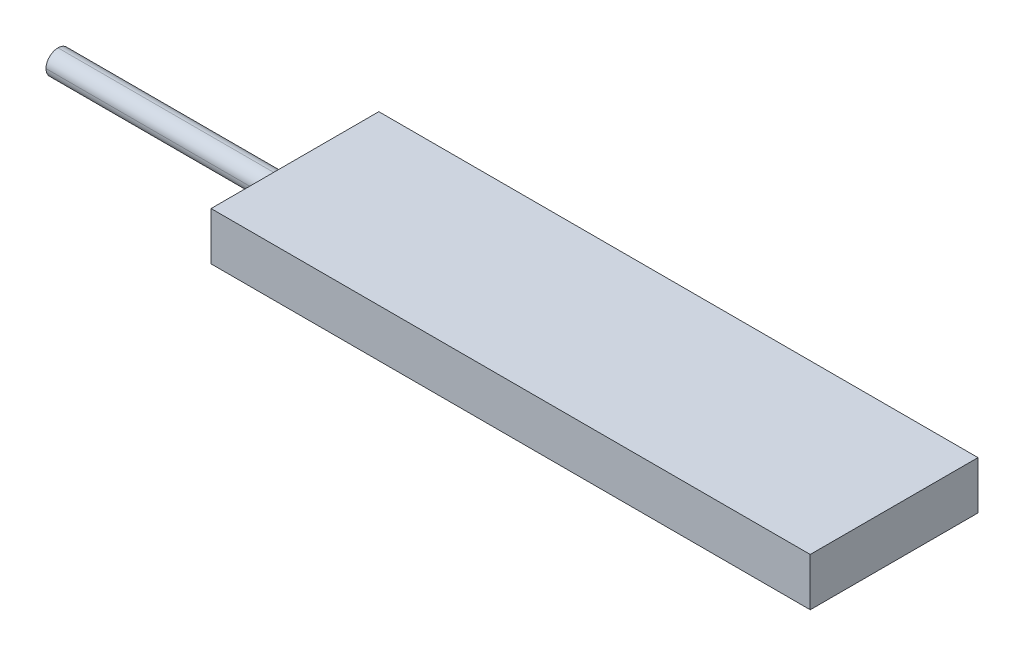
from build123d import *

# Parameters (mm, degrees)
BOSS_EXTRUDE1_DEPTH = 2
SKETCH1_3_W         = 10
SKETCH1_3_H         = 1
BOSS_EXTRUDE2_DEPTH = 1
FILLET1_R           = 0.5


# Read off the part's stored shape, not the designer's step: Split1
with BuildPart() as part:
    # Sketch1 → Boss-Extrude1 (new body)
    with BuildSketch(Plane(origin=(0, 0, 0), x_dir=(1, 0, 0), z_dir=(0, 1, 0))):
        Polygon((25, 0), (25, 7), (0, 7), (0, 4.113157824), (0, 3.113157824), (0, 0), align=None)
    extrude(amount=BOSS_EXTRUDE1_DEPTH)

    # Sketch1<3> → Boss-Extrude2 (add)
    with BuildSketch(Plane(origin=(0, 0, 0), x_dir=(1, 0, 0), z_dir=(0, 1, 0))):
        with Locations((-5, 3.613157824)):
            Rectangle(SKETCH1_3_W, SKETCH1_3_H)
    extrude(amount=BOSS_EXTRUDE2_DEPTH)


with BuildPart() as body_2:
    # Split1: the piece on the far side of the plane
    add(part.part)
    split(bisect_by=Plane.YZ, keep=Keep.BOTTOM)

    # Fillet1
    # the kernel refuses this fillet: 0.5 mm, written as the material it takes off along each edge
    with BuildSketch(Plane(origin=(1.25, 0, -4.113157824), x_dir=(0, 0, 1), z_dir=(-1, 0, 0)), Plane(origin=(1.25, 1, -4.113157824), x_dir=(0, -1, 0), z_dir=(-1, 0, 0)), Plane(origin=(-11.25, 0, -3.113157824), x_dir=(0, 0, -1), z_dir=(1, 0, 0)), Plane(origin=(-11.25, 1, -3.113157824), x_dir=(0, -1, 0), z_dir=(1, 0, 0))) as fillet1_piece_1:
        with BuildLine():
            CenterArc((FILLET1_R, FILLET1_R), FILLET1_R, 180, 90)
            Line((0, FILLET1_R), (0, 0))
            Line((0, 0), (FILLET1_R, 0))
        make_face()
    extrude(amount=12.5, mode=Mode.SUBTRACT)


with BuildPart() as part_1:
    add(part.part)

    # Split1
    split(bisect_by=Plane.YZ, keep=Keep.TOP)


solid = Compound([body_2.part, part_1.part])
